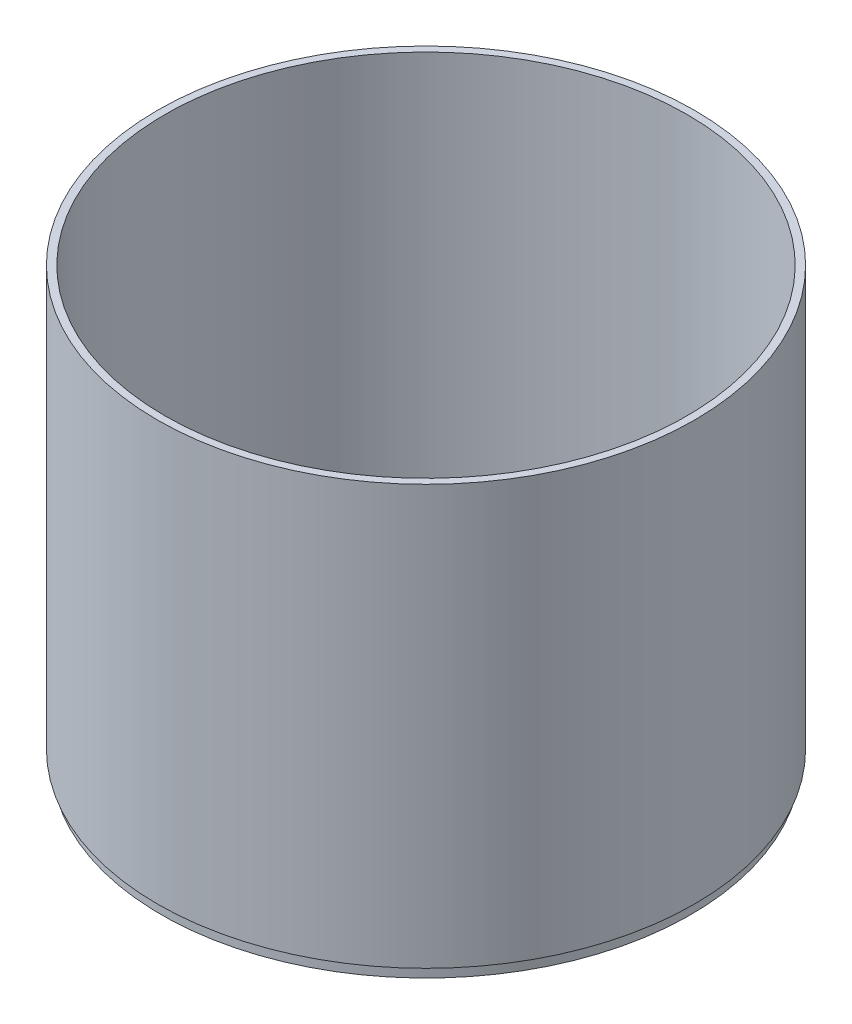
from build123d import *


with BuildPart() as part:
    # Schizzo1 → Rivoluzione1 (revolve)
    with BuildSketch(Plane.XY):
        Polygon((-71, 0), (-71, 3), (-71, 117), (-73, 117), (-73, 3), (-72, 3), (-72, 0), align=None)
    revolve(axis=Axis((0, 0, 0), (0, 1, 0)))


solid = part.part
